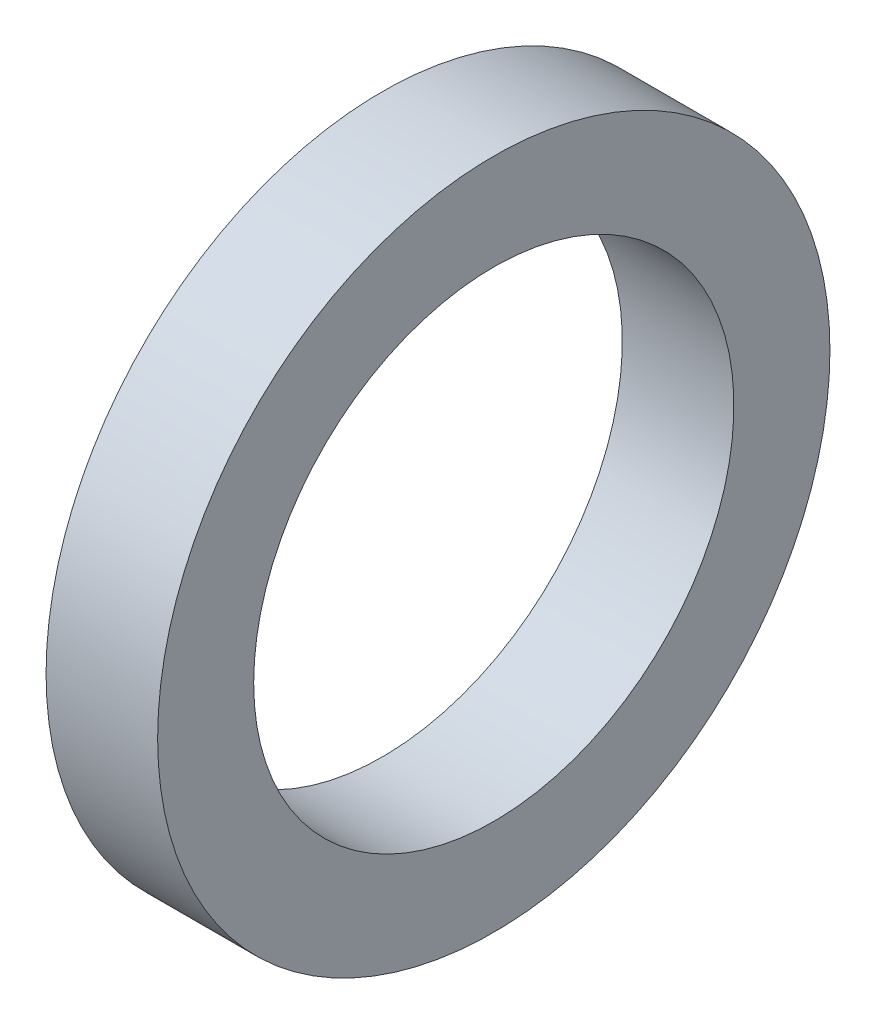
from build123d import *

# Parameters (mm, degrees)
SKETCH3_W = 6.97000003
SKETCH3_H = 6.000000065


with BuildPart() as part:
    # Sketch3 → Revolve1 (revolve)
    with BuildSketch(Plane.XY):
        with Locations((26.415400179, 18.000000005)):
            Rectangle(SKETCH3_W, SKETCH3_H)
    revolve(axis=Axis((0, 0, 0), (1, 0, 0)))


solid = part.part
